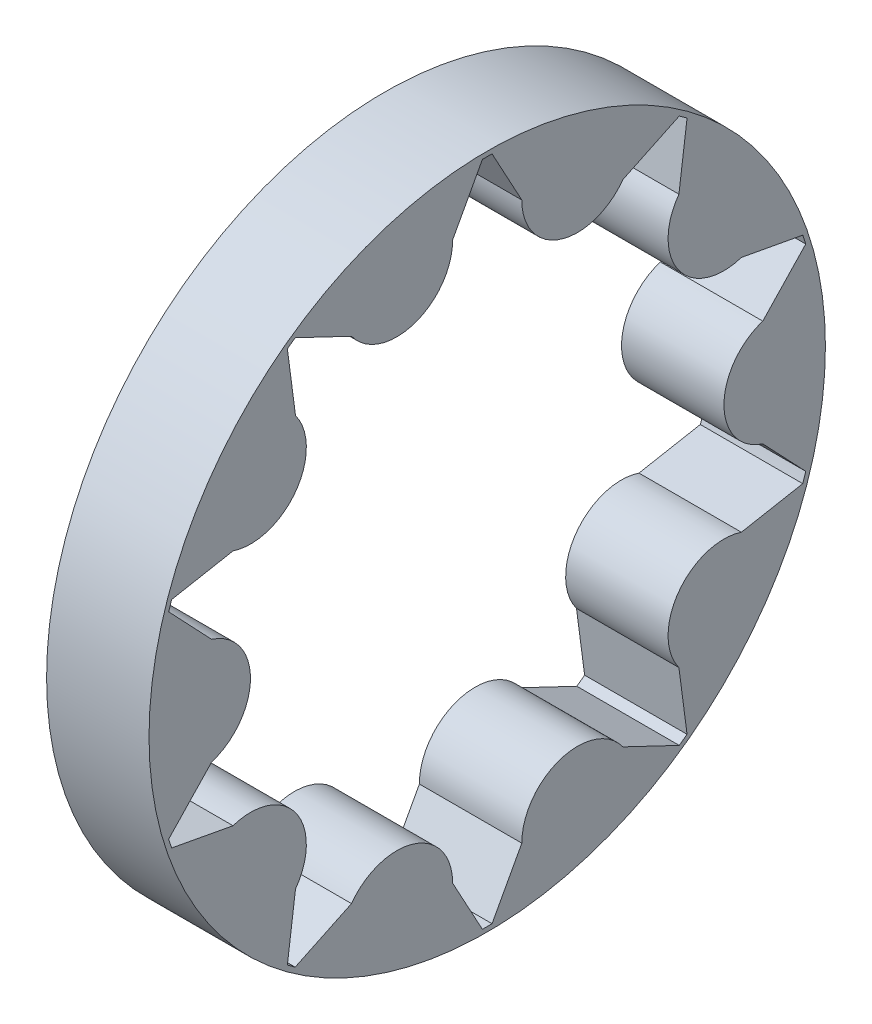
from build123d import *

# Parameters (mm, degrees)
BOSS_EXTRUDE1_DEPTH = 5.3
CIRPATTERN2_COUNT   = 10


with BuildPart() as part:
    # Sketch1 → Boss-Extrude1 (new body)
    with BuildSketch(Plane(origin=(0, 0, 0), x_dir=(0, 0, -1), z_dir=(1, 0, 0))):
        with BuildLine():
            Line((0, 17.5), (0, 17.25))
            ThreePointArc((0, 17.25), (0.125, 17.249547096), (0.249993436, 17.248188406))
            Line((0.249993436, 17.248188406), (1.790913835, 14.411052964))
            ThreePointArc((1.790913835, 14.411052964), (3.785458181, 11.650442325), (7.021724675, 12.711459495))
            Line((7.021724675, 12.711459495), (9.935981835, 14.101019997))
            ThreePointArc((9.935981835, 14.101019997), (10.037902267, 14.028649902), (10.139295602, 13.955543153))
            Line((10.139295602, 13.955543153), (10.286241915, 14.157797402))
            ThreePointArc((10.286241915, 14.157797402), (5.407797402, 16.643489035), (0, 17.5))
        make_face()
    boss_extrude1 = extrude(amount=BOSS_EXTRUDE1_DEPTH)

    # CirPattern2: Boss-Extrude1 ×10 about axis
    cirpattern2_axis = Axis((5.3, 0, 0), (-1, 0, 0))
    for i in range(1, CIRPATTERN2_COUNT):
        add(boss_extrude1.rotate(cirpattern2_axis, i * 360 / CIRPATTERN2_COUNT))


solid = part.part
